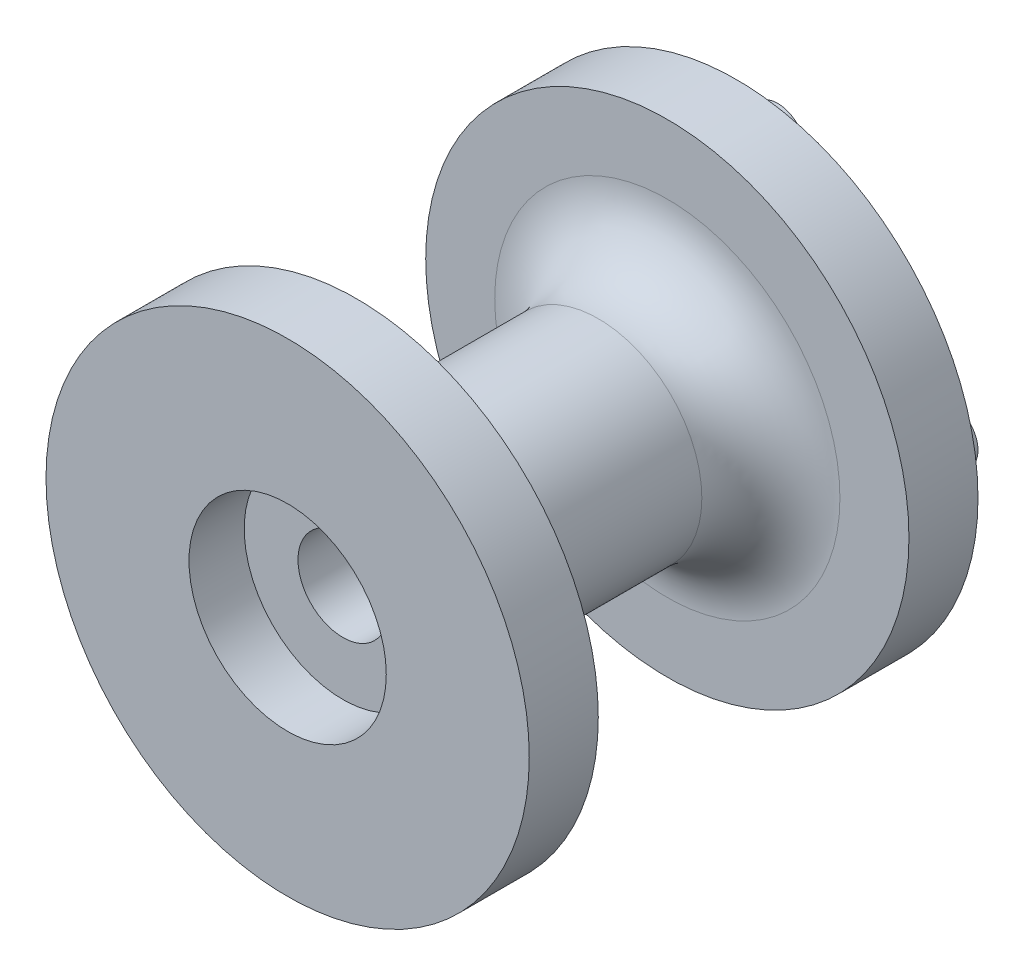
from build123d import *

# Parameters (mm, degrees)
ESQUISSE28_R             = 6.5
ENL_V_MAT_EXTRU_16_DEPTH = 76.4917214
CONG_1_R                 = 10
ESQUISSE29_R             = 4
BOSS_EXTRU_1_DEPTH       = 6
ESQUISSE30_R             = 19.501187477
ESQUISSE30_R_2           = 15
BOSS_EXTRU_2_DEPTH       = 9.735855
CONG_2_R                 = 10


with BuildPart() as part:
    # Esquisse27 → Révolution1 (revolve)
    with BuildSketch(Plane(origin=(0, 0, 0), x_dir=(0, 0, -1), z_dir=(1, 0, 0)), mode=Mode.PRIVATE) as r_volution1_sk:
        Polygon((8, 14.29), (8, 0), (57, 0), (57, 14.29), (65, 14.29), (65, 35), (55, 35), (55, 19.501187477), (64.735853824, 19.501187477), (64.735853824, 15), (10, 15), (10, 35), (0, 35), (0, 14.29), align=None)
    revolve(r_volution1_sk.sketch.rotate(Axis((0, 0, -10), (0, 0, -1)), 90), axis=Axis((0, 0, -10), (0, 0, -1)))

    # Esquisse28 → Enlèv. mat.-Extru.16 (cut, through all)
    with BuildSketch(Plane(origin=(0, 0, -57), x_dir=(-1, 0, 0), z_dir=(0, 0, -1))):
        Circle(ESQUISSE28_R)
    extrude(amount=-ENL_V_MAT_EXTRU_16_DEPTH, mode=Mode.SUBTRACT)

    # Congé1
    cong_1_edges = [part.edges().sort_by_distance(p)[0] for p in [
        (-15, 0, -10),
    ]]
    fillet(cong_1_edges, radius=CONG_1_R)

    # Esquisse29 → Boss.-Extru.1 (add)
    with BuildSketch(Plane(origin=(0, 0, -65), x_dir=(-1, 0, 0), z_dir=(0, 0, -1))):
        with Locations(Location((0, 25, 0), (0, 0, 180))):
            Circle(ESQUISSE29_R)
        with Locations(Location((25, 0, 0), (0, 0, 180))):
            Circle(ESQUISSE29_R)
        with Locations(Location((0, -25, 0), (0, 0, 180))):
            Circle(ESQUISSE29_R)
        with Locations(Location((-25, 0, 0), (0, 0, 180))):
            Circle(ESQUISSE29_R)
    extrude(amount=BOSS_EXTRU_1_DEPTH)

    # Esquisse30 → Boss.-Extru.2 (add)
    with BuildSketch(Plane.XY.offset(-64.735853824)):
        Circle(ESQUISSE30_R)
        Circle(ESQUISSE30_R_2, mode=Mode.SUBTRACT)
    extrude(amount=BOSS_EXTRU_2_DEPTH)

    # Congé2
    # the kernel refuses this fillet: 10 mm, written as the material it adds along each edge
    with BuildSketch(Plane(origin=(0, 0, -54.999998824), x_dir=(1, 0, 0), z_dir=(0, -1, 0))) as cong_2_piece_1:
        with BuildLine():
            CenterArc((15 + CONG_2_R, CONG_2_R), CONG_2_R, 180, 90)
            Line((15 + CONG_2_R, 0), (15 + CONG_2_R, -CONG_2_R * 0.02))
            Line((15 + CONG_2_R, -CONG_2_R * 0.02), (15 - CONG_2_R * 0.02, -CONG_2_R * 0.02))
            Line((15 - CONG_2_R * 0.02, -CONG_2_R * 0.02), (15 - CONG_2_R * 0.02, CONG_2_R))
            Line((15 - CONG_2_R * 0.02, CONG_2_R), (15, CONG_2_R))
        make_face()
    revolve(axis=Axis((0, 0, -54.999998824), (0, 0, 1)))


solid = part.part
